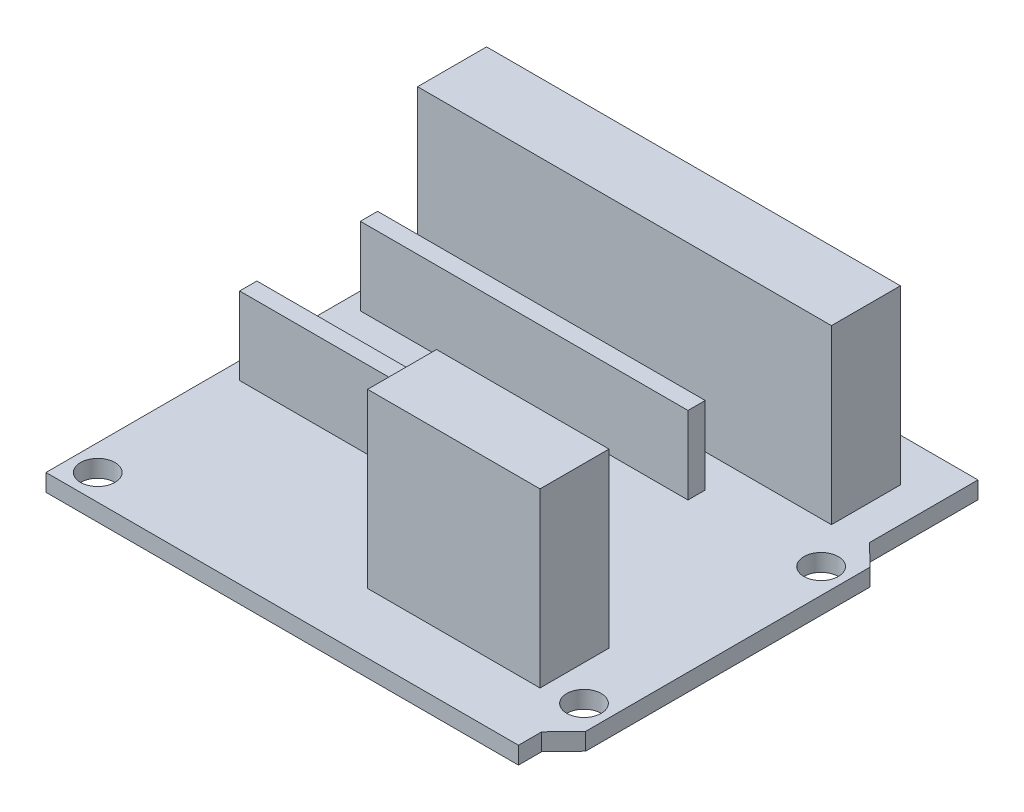
from build123d import *

# Parameters (mm, degrees)
SKETCH1_R           = 2
BOSS_EXTRUDE1_DEPTH = 2
SKETCH2_W           = 38
SKETCH2_H           = 2
BOSS_EXTRUDE2_DEPTH = 9
LPATTERN1_COUNT     = 2
LPATTERN1_PITCH     = 14
SKETCH3_W           = 20
SKETCH3_H           = 8
BOSS_EXTRUDE3_DEPTH = 20
SKETCH4_W           = 48
SKETCH4_H           = 8
BOSS_EXTRUDE4_DEPTH = 20
SKETCH6_R           = 0.5
BOSS_EXTRUDE6_DEPTH = 2.2
LPATTERN2_COUNT     = 2
LPATTERN2_PITCH     = 5


with BuildPart() as part:
    # Sketch1 → Boss-Extrude1 (new body)
    with BuildSketch(Plane(origin=(0, 0, 0), x_dir=(1, 0, 0), z_dir=(0, 1, 0))):
        Polygon((54.8, 40.7), (54.8, 53.3), (0, 53.3), (0, 0), (54.8, 0), (54.8, 2.695833333), (57.3, 5.3), (57.3, 38.3), align=None)
        with Locations((3, 3)):
            Circle(SKETCH1_R, mode=Mode.SUBTRACT)
        with Locations((54.4, 8)):
            Circle(SKETCH1_R, mode=Mode.SUBTRACT)
        with Locations((4, 50.8)):
            Circle(SKETCH1_R, mode=Mode.SUBTRACT)
        with Locations((54.4, 35.5)):
            Circle(SKETCH1_R, mode=Mode.SUBTRACT)
    extrude(amount=BOSS_EXTRUDE1_DEPTH)

    # Sketch2 → Boss-Extrude2 (add)
    with BuildSketch(Plane(origin=(0, 2, 0), x_dir=(1, 0, 0), z_dir=(0, 1, 0))):
        with Locations((21, 35.460185898)):
            Rectangle(SKETCH2_W, SKETCH2_H)
    boss_extrude2 = extrude(amount=BOSS_EXTRUDE2_DEPTH)

    # LPattern1: Boss-Extrude2 ×2
    with Locations(*[(0, 0, i * LPATTERN1_PITCH) for i in range(1, LPATTERN1_COUNT)]):
        add(boss_extrude2)

    # Sketch3 → Boss-Extrude3 (add)
    with BuildSketch(Plane(origin=(0, 2, 0), x_dir=(1, 0, 0), z_dir=(0, 1, 0))):
        with Locations((40.3, 11)):
            Rectangle(SKETCH3_W, SKETCH3_H)
    extrude(amount=BOSS_EXTRUDE3_DEPTH)

    # Sketch4 → Boss-Extrude4 (add)
    with BuildSketch(Plane(origin=(0, 2, 0), x_dir=(1, 0, 0), z_dir=(0, 1, 0))):
        with Locations((26.8, 44.3)):
            Rectangle(SKETCH4_W, SKETCH4_H)
    extrude(amount=BOSS_EXTRUDE4_DEPTH)

    # Sketch6 → Boss-Extrude6 (add)
    with BuildSketch(Plane.XZ):
        with Locations((6.488337658, -7.768048355)):
            Circle(SKETCH6_R)
    boss_extrude6 = extrude(amount=BOSS_EXTRUDE6_DEPTH)

    # LPattern2: Boss-Extrude6 ×2
    with Locations(*[Vector(0.9316516014644738, 0, -0.36335284984252075) * (i * LPATTERN2_PITCH) for i in range(1, LPATTERN2_COUNT)]):
        add(boss_extrude6)


solid = part.part
